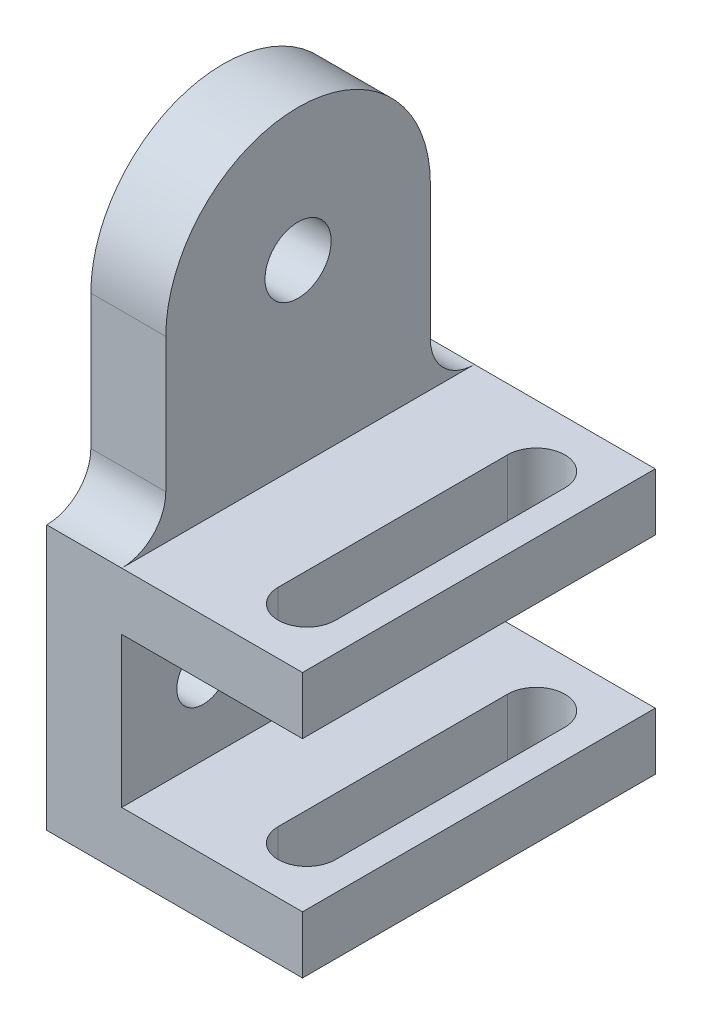
from build123d import *

# Parameters (mm, degrees)
BOSS_EXTRUDE1_DEPTH       = 40
SKETCH10_R                = 6
CUT_EXTRUDE1_DEPTH        = 80
BOSS_EXTRUDE2_START       = -17
BOSS_EXTRUDE2_OUTLINE_R   = 6
BOSS_EXTRUDE2_OUTLINE_R_2 = 7.5
BOSS_EXTRUDE2_DEPTH       = 17
CUT_EXTRUDE3_DEPTH        = 100.670707833


# Read off the part's stored shape, not the designer's step: Boss-Extrude2
with BuildPart() as part:
    # Sketch9 → Boss-Extrude1 (new, symmetric)
    with BuildSketch(Plane.XY):
        Polygon((0, 0), (0, -60), (58, -60), (58, -47), (17, -47), (17, -13), (58, -13), (58, 0), align=None)
    extrude(amount=BOSS_EXTRUDE1_DEPTH, both=True)

    # Sketch10 → Cut-Extrude1 (cut)
    with BuildSketch(Plane.ZY):
        with Locations(Location((-21.5, -30, 0), (0, 0, 270))):
            Circle(SKETCH10_R)
        with Locations(Location((21.5, -30, 0), (0, 0, 270))):
            Circle(SKETCH10_R)
    extrude(amount=-CUT_EXTRUDE1_DEPTH, mode=Mode.SUBTRACT)

    # Sketch11 → Cut-Extrude3 (cut, through all)
    with BuildSketch(Plane(origin=(0, 0, 0), x_dir=(1, 0, 0), z_dir=(0, 1, 0))):
        with BuildLine():
            Line((51.5, 26), (51.5, -26))
            ThreePointArc((51.5, -26), (45, -32.5), (38.5, -26))
            Line((38.5, -26), (38.5, 26))
            ThreePointArc((38.5, 26), (45, 32.5), (51.5, 26))
        make_face()
    extrude(amount=-CUT_EXTRUDE3_DEPTH, mode=Mode.SUBTRACT)


with BuildPart() as body_2:
    # Boss-Extrude2 outline → Boss-Extrude2 (new body)
    with BuildSketch(Plane.ZY.offset(BOSS_EXTRUDE2_START)):
        with BuildLine():
            Line((0, -60), (0, 0))
            Line((0, 0), (40, 0))
            ThreePointArc((40, 0), (32.928932188, 2.928932188), (30, 10))
            Line((30, 10), (30, 40.5))
            ThreePointArc((30, 40.5), (0, 70.5), (-30, 40.5))
            Line((-30, 40.5), (-30, 10))
            ThreePointArc((-30, 10), (-32.928932188, 2.928932188), (-40, 0))
            Line((-40, 0), (-40, -60))
            Line((-40, -60), (0, -60))
        make_face()
        with Locations((-21.5, -30)):
            Circle(BOSS_EXTRUDE2_OUTLINE_R, mode=Mode.SUBTRACT)
        with Locations((0, 40.5)):
            Circle(BOSS_EXTRUDE2_OUTLINE_R_2, mode=Mode.SUBTRACT)
    extrude(amount=BOSS_EXTRUDE2_DEPTH)


solid = Compound([part.part, body_2.part])
